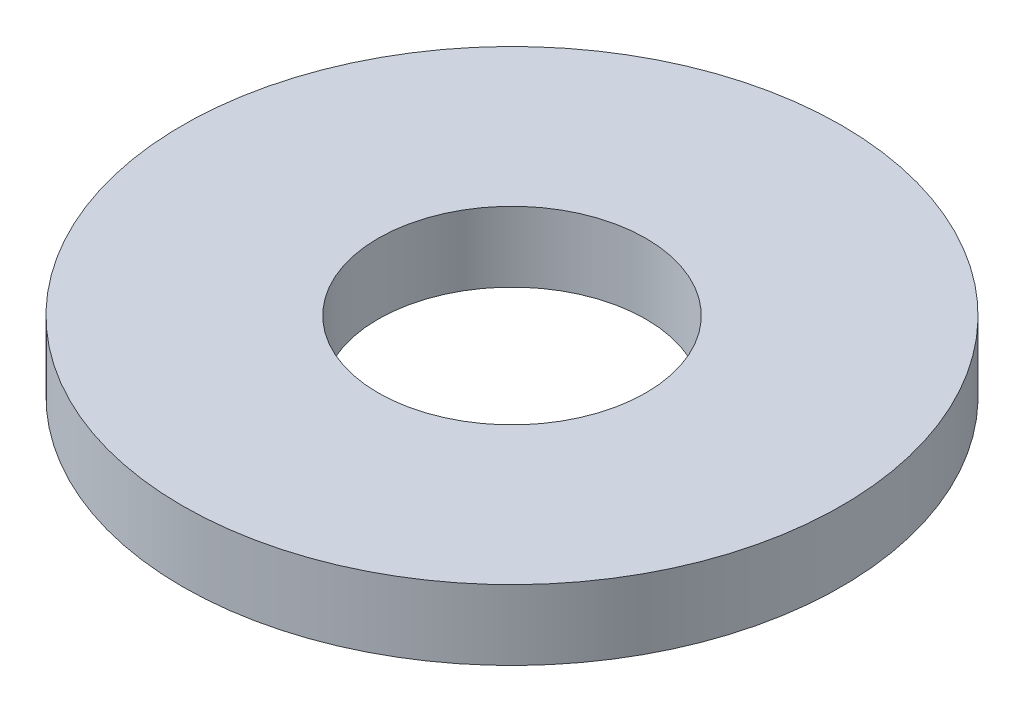
from build123d import *

# Parameters (mm, degrees)
SKETCH1_R           = 80
BOSS_EXTRUDE1_DEPTH = 17
SKETCH2_R           = 32.5
CUT_EXTRUDE1_DEPTH  = 115.407167608


with BuildPart() as part:
    # Sketch1 → Boss-Extrude1 (new body)
    with BuildSketch(Plane(origin=(0, 0, 0), x_dir=(1, 0, 0), z_dir=(0, 1, 0))):
        Circle(SKETCH1_R)
    extrude(amount=BOSS_EXTRUDE1_DEPTH)

    # Sketch2 → Cut-Extrude1 (cut, through all)
    with BuildSketch(Plane(origin=(0, 0, 0), x_dir=(1, 0, 0), z_dir=(0, 1, 0))):
        Circle(SKETCH2_R)
    extrude(amount=CUT_EXTRUDE1_DEPTH, mode=Mode.SUBTRACT)


solid = part.part
